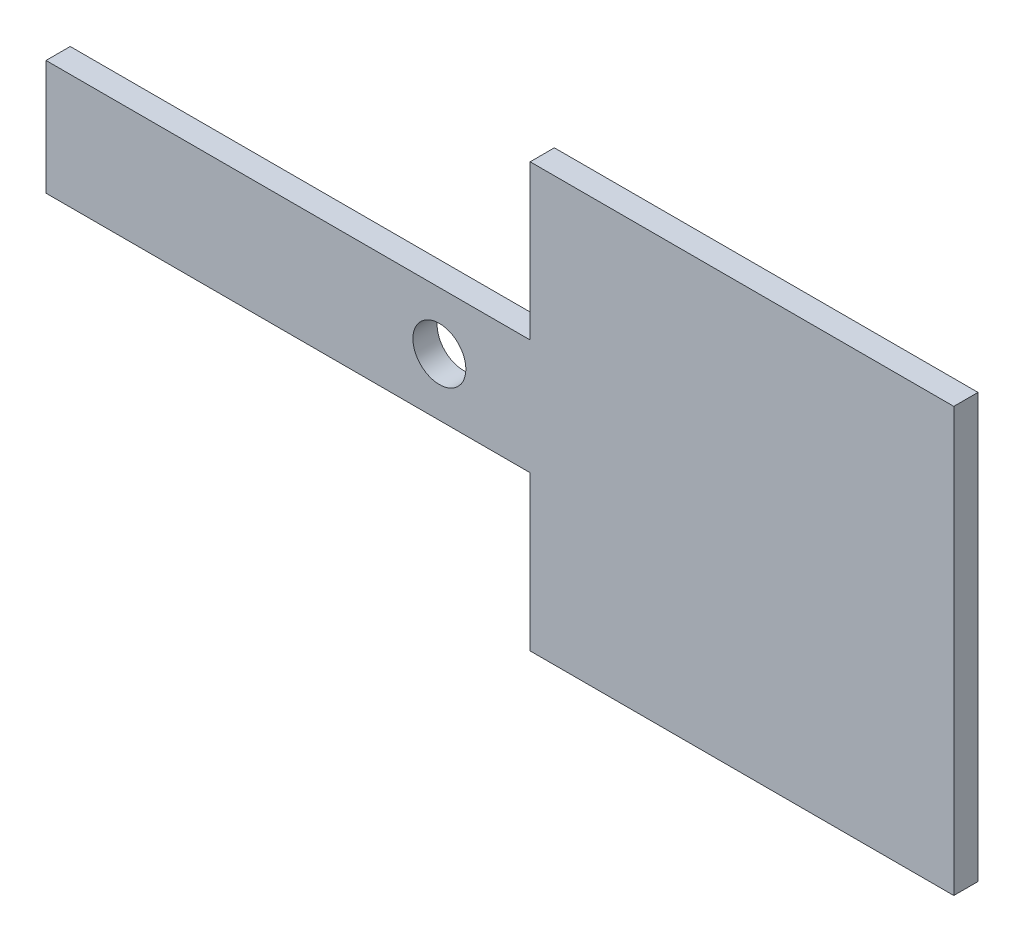
from build123d import *

# Parameters (mm, degrees)
SKETCH1_R           = 1.75
BOSS_EXTRUDE1_DEPTH = 1.6


with BuildPart() as part:
    # Sketch1 → Boss-Extrude1 (new body)
    with BuildSketch(Plane.XY):
        Polygon((28, 14), (0, 14), (0, 3.8), (-32, 3.8), (-32, -3.8), (0, -3.8), (0, -14), (28, -14), align=None)
        with Locations((-6, 0)):
            Circle(SKETCH1_R, mode=Mode.SUBTRACT)
    extrude(amount=BOSS_EXTRUDE1_DEPTH)


solid = part.part
